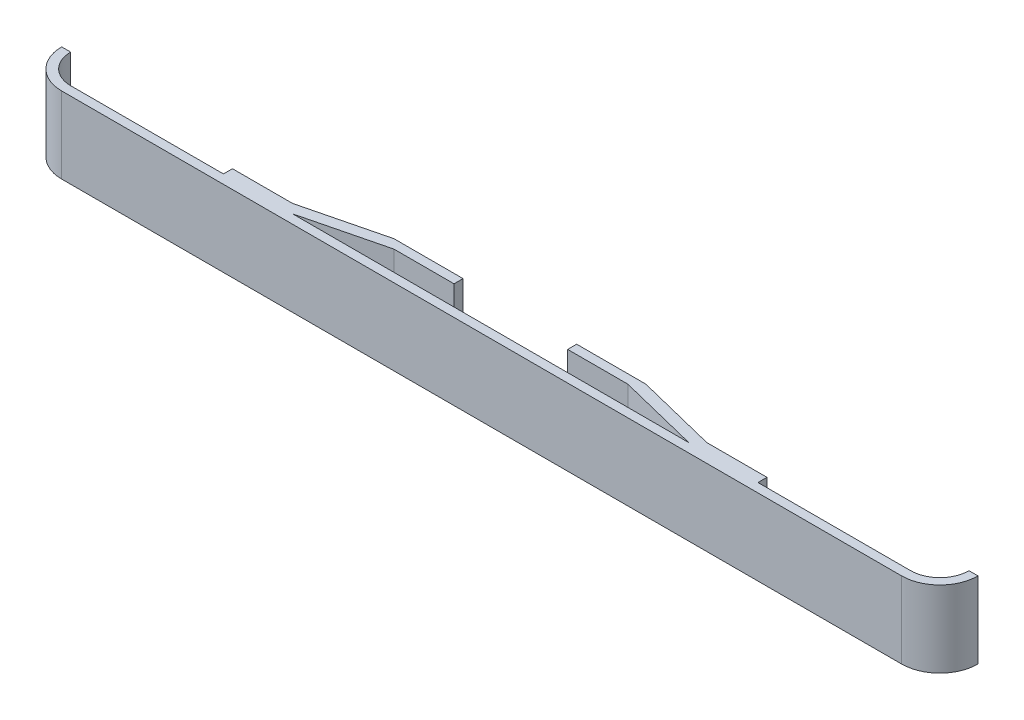
from build123d import *

# Parameters (mm, degrees)
SKETCH1_W           = 304.8
SKETCH1_H           = 25.4
BOSS_EXTRUDE2_DEPTH = 12.7
FILLET1_R           = 12.7
CUT_EXTRUDE3_DEPTH  = 281.209703849
SKETCH8_W           = 70
SKETCH8_H           = 25.4
BOSS_EXTRUDE3_DEPTH = 9.7
CUT_EXTRUDE4_DEPTH  = 281.209703849
CUT_EXTRUDE5_DEPTH  = 281.209703849


with BuildPart() as part:
    # Sketch1 → Boss-Extrude2 (new body)
    with BuildSketch(Plane.XY):
        with Locations((126.366978193, -2.136448598)):
            Rectangle(SKETCH1_W, SKETCH1_H)
    extrude(amount=BOSS_EXTRUDE2_DEPTH)

    # Fillet1
    fillet1_edges = [part.edges().sort_by_distance(p)[0] for p in [
        (-26.033021807, -2.136448598, 12.7),
        (278.766978193, -2.136448598, 12.7),
    ]]
    fillet(fillet1_edges, radius=FILLET1_R - 0.0001)  # a hair under: the kernel refuses the full size

    # Sketch6 → Cut-Extrude3 (cut, through all)
    with BuildSketch(Plane(origin=(0, 10.563551402, 0), x_dir=(1, 0, 0), z_dir=(0, 1, 0))):
        with BuildLine():
            Line((-23.033021807, 0), (275.766978193, 0))
            ThreePointArc((275.766978193, 0), (272.925913971, -6.858935778), (266.066978193, -9.7))
            Line((266.066978193, -9.7), (-13.333021807, -9.7))
            ThreePointArc((-13.333021807, -9.7), (-20.191957584, -6.858935778), (-23.033021807, 0))
        make_face()
    extrude(amount=-CUT_EXTRUDE3_DEPTH, mode=Mode.SUBTRACT)

    # Sketch8 → Boss-Extrude3 (add)
    with BuildSketch(Plane(origin=(0, 0, 9.7), x_dir=(-1, 0, 0), z_dir=(0, 0, -1))):
        with Locations((-180.266978193, -2.136448598)):
            Rectangle(SKETCH8_W, SKETCH8_H)
        with Locations((-72.466978193, -2.136448598)):
            Rectangle(SKETCH8_W, SKETCH8_H)
    extrude(amount=BOSS_EXTRUDE3_DEPTH)

    # Sketch9 → Cut-Extrude4 (cut, through all)
    with BuildSketch(Plane(origin=(0, 10.563551402, 0), x_dir=(1, 0, 0), z_dir=(0, 1, 0))):
        Polygon((145.266978193, -9.7), (165.266978193, -9.7), (192.266978193, -9.7), (165.266978193, -3), (145.266978193, -3), align=None)
        Polygon((215.266978193, -6.7), (195.266978193, -6.7), (168.266978193, 0), (215.266978193, 0), align=None)
    extrude(amount=-CUT_EXTRUDE4_DEPTH, mode=Mode.SUBTRACT)

    # Sketch12 → Cut-Extrude5 (cut, through all)
    with BuildSketch(Plane(origin=(0, 10.563551402, 0), x_dir=(1, 0, 0), z_dir=(0, 1, 0))):
        Polygon((107.466978193, -9.7), (107.466978193, -3), (87.466978193, -3), (60.466978193, -9.7), align=None)
        Polygon((37.466978193, -6.7), (57.466978193, -6.7), (84.466978193, 0), (37.466978193, 0), align=None)
    extrude(amount=-CUT_EXTRUDE5_DEPTH, mode=Mode.SUBTRACT)


solid = part.part
